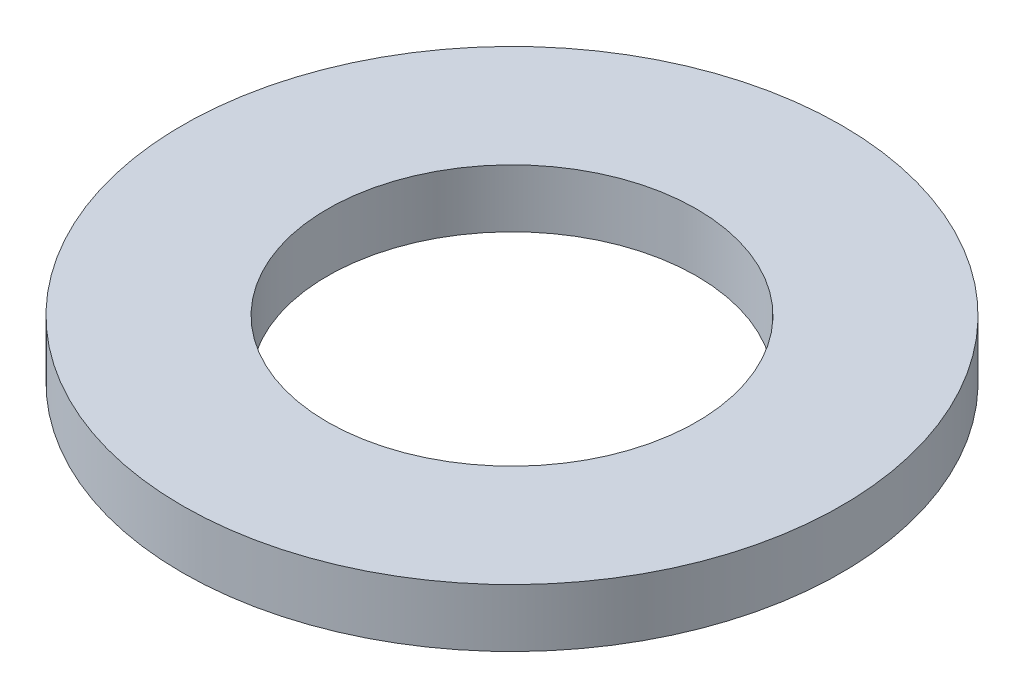
from build123d import *

# Parameters (mm, degrees)
SKETCH1_R           = 62.5
BOSS_EXTRUDE1_DEPTH = 11
SKETCH2_R           = 35
CUT_EXTRUDE1_DEPTH  = 90.070197036


with BuildPart() as part:
    # Sketch1 → Boss-Extrude1 (new body)
    with BuildSketch(Plane(origin=(0, 0, 0), x_dir=(1, 0, 0), z_dir=(0, 1, 0))):
        Circle(SKETCH1_R)
    extrude(amount=BOSS_EXTRUDE1_DEPTH)

    # Sketch2 → Cut-Extrude1 (cut, through all)
    with BuildSketch(Plane(origin=(0, 0, 0), x_dir=(1, 0, 0), z_dir=(0, 1, 0))):
        Circle(SKETCH2_R)
    extrude(amount=CUT_EXTRUDE1_DEPTH, mode=Mode.SUBTRACT)


solid = part.part
